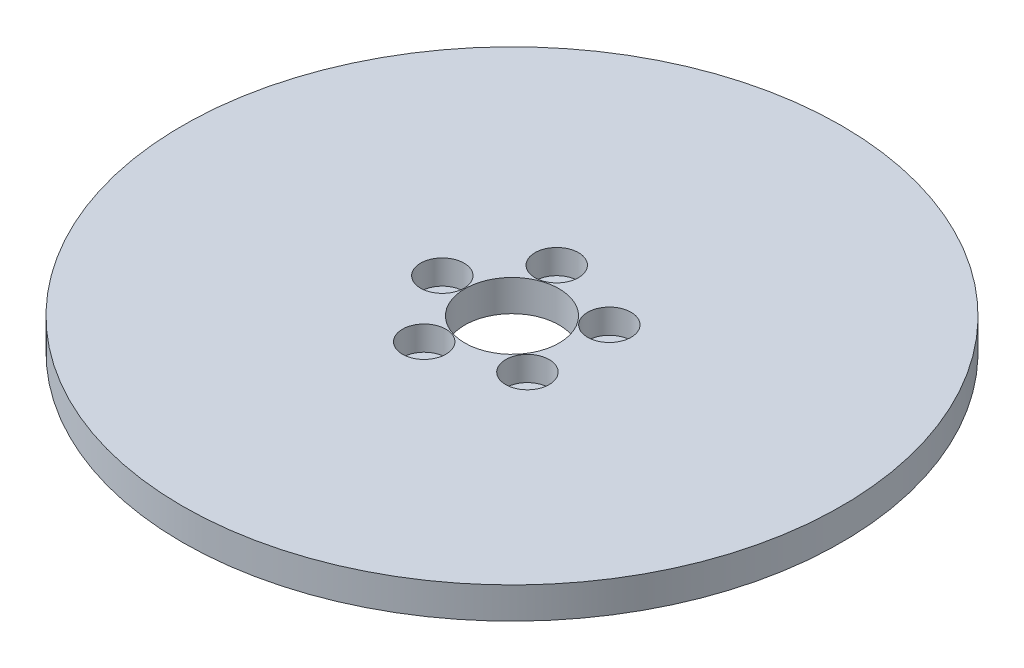
from build123d import *

# Parameters (mm, degrees)
SKETCH1_R           = 52.5
BOSS_EXTRUDE1_DEPTH = 5
SKETCH2_R           = 7.5
CUT_EXTRUDE1_DEPTH  = 75.414380331
SKETCH3_R           = 3.462323391
CUT_EXTRUDE2_DEPTH  = 3.896574918
CIRPATTERN1_COUNT   = 5


with BuildPart() as part:
    # Sketch1 → Boss-Extrude1 (new body)
    with BuildSketch(Plane(origin=(0, 0, 0), x_dir=(1, 0, 0), z_dir=(0, 1, 0))):
        Circle(SKETCH1_R)
    extrude(amount=BOSS_EXTRUDE1_DEPTH)

    # Sketch2 → Cut-Extrude1 (cut, through all)
    with BuildSketch(Plane(origin=(0, 0, 0), x_dir=(1, 0, 0), z_dir=(0, 1, 0))):
        Circle(SKETCH2_R)
    extrude(amount=CUT_EXTRUDE1_DEPTH, mode=Mode.SUBTRACT)

    # Sketch3 → Cut-Extrude2 (cut)
    with BuildSketch(Plane(origin=(0, 5, 0), x_dir=(1, 0, 0), z_dir=(0, 1, 0))):
        with Locations((-11.10196659, 0)):
            Circle(SKETCH3_R)
    cut_extrude2 = extrude(amount=-CUT_EXTRUDE2_DEPTH, mode=Mode.SUBTRACT)

    # CirPattern1: Cut-Extrude2 ×5 about axis
    cirpattern1_axis = Axis((0, 0, 0), (0, 1, 0))
    for i in range(1, CIRPATTERN1_COUNT):
        add(cut_extrude2.rotate(cirpattern1_axis, i * 360 / CIRPATTERN1_COUNT), mode=Mode.SUBTRACT)


solid = part.part
